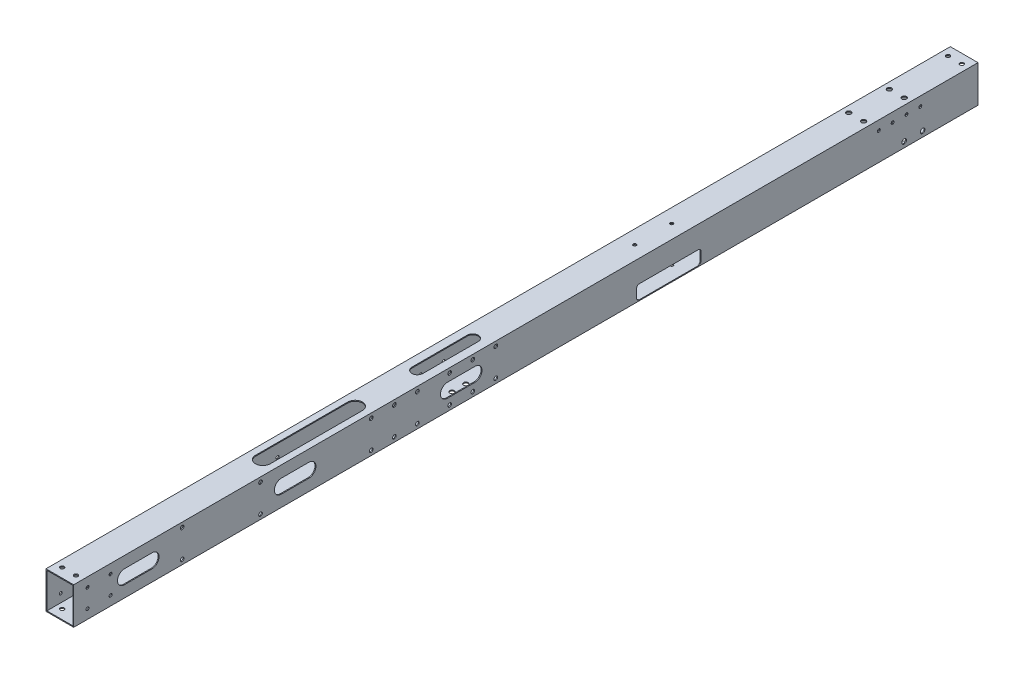
from build123d import *

# Parameters (mm, degrees)
SKETCH_1_W             = 30
SKETCH_1_H             = 40
SKETCH_1_W_2           = 28
SKETCH_1_H_2           = 38
EXTRUDE_1_DEPTH        = 940
SKETCH_5_R             = 2.5
CUT_EXTRUDE_3_DEPTH    = 941.97024395
CUT_EXTRUDE_4_DEPTH    = 1
SKETCH_7_R             = 1.75
CUT_EXTRUDE_5_DEPTH    = 1
SKETCH_17_W            = 30
SKETCH_17_H            = 40
SKETCH_17_W_2          = 28
SKETCH_17_H_2          = 38
EXTRUDE_2_DEPTH        = 20
SKETCH_18_W            = 30
SKETCH_18_H            = 40
SKETCH_18_W_2          = 28
SKETCH_18_H_2          = 38
EXTRUDE_3_DEPTH        = 20
SKETCH_19_R            = 2.1
CUT_EXTRUDE_16_DEPTH   = 961.950050731
SKETCH_20_R            = 1.6
CUT_EXTRUDE_17_DEPTH   = 961.67684473
SKETCH_21_R            = 2.5
SKETCH_21_R_2          = 1.6
CUT_EXTRUDE_18_DEPTH   = 961.67684473
SKETCH_23_R            = 2.5
CUT_EXTRUDE_19_DEPTH   = 961.950050731
SKETCH_24_R            = 4.5
CUT_EXTRUDE_20_DEPTH   = 10
SKETCH_26_R            = 2
CUT_EXTRUDE_22_DEPTH   = 961.67684473
CUT_EXTRUDE_28_DEPTH   = 10
PATTERN_LINEAR_4_COUNT = 2
PATTERN_LINEAR_4_PITCH = 255
PATTERN_LINEAR_8_COUNT = 2
PATTERN_LINEAR_8_PITCH = 205
PATTERN_LINEAR_9_COUNT = 2
PATTERN_LINEAR_9_PITCH = 230
CUT_EXTRUDE_START      = -20
SKETCH_34_R            = 1.75
CUT_EXTRUDE_29_DEPTH   = 20
SKETCH_35_R            = 1.5
CUT_EXTRUDE_30_DEPTH   = 10
CUT_EXTRUDE_31_DEPTH   = 10
SKETCH_37_R            = 1.65
CUT_EXTRUDE_32_DEPTH   = 52
SKETCH_39_R            = 1.75
CUT_EXTRUDE_33_DEPTH   = 10
SKETCH_40_W            = 70
SKETCH_40_H            = 15
CUT_EXTRUDE_34_DEPTH   = 10
EXTRUDE_5_DEPTH        = 1
SKETCH_43_W            = 38.522995696
SKETCH_43_H            = 13.00002022
EXTRUDE_6_DEPTH        = 1
FILLET_1_R             = 3
CUT_EXTRUDE_35_DEPTH   = 10


with BuildPart() as part:
    # 草图1 → 凸台-拉伸1 (new body)
    with BuildSketch(Plane.XY):
        Rectangle(SKETCH_1_W, SKETCH_1_H)
        Rectangle(SKETCH_1_W_2, SKETCH_1_H_2, mode=Mode.SUBTRACT)
    extrude(amount=EXTRUDE_1_DEPTH)

    # 草图5 → 切除-拉伸3 (cut, through all)
    with BuildSketch(Plane.XZ.offset(20)):
        with Locations((-8, 53)):
            Circle(SKETCH_5_R)
        with Locations((8, 53)):
            Circle(SKETCH_5_R)
        with Locations((-8, 97)):
            Circle(SKETCH_5_R)
        with Locations((8, 97)):
            Circle(SKETCH_5_R)
    extrude(amount=-CUT_EXTRUDE_3_DEPTH, mode=Mode.SUBTRACT)

    # 草图6 → 切除-拉伸4 (cut)
    with BuildSketch(Plane(origin=(15, 0, 0), x_dir=(0, 0, -1), z_dir=(1, 0, 0))):
        with BuildLine():
            Line((-345, -7.5), (-375, -7.5))
            ThreePointArc((-375, -7.5), (-382.5, 0), (-375, 7.5))
            Line((-375, 7.5), (-345, 7.5))
            ThreePointArc((-345, 7.5), (-337.5, 0), (-345, -7.5))
        make_face()
        with BuildLine():
            Line((-525, -7.5), (-555, -7.5))
            ThreePointArc((-555, -7.5), (-562.5, 0), (-555, 7.5))
            Line((-555, 7.5), (-525, 7.5))
            ThreePointArc((-525, 7.5), (-517.5, 0), (-525, -7.5))
        make_face()
        with BuildLine():
            Line((-705, -7.5), (-735, -7.5))
            ThreePointArc((-735, -7.5), (-742.5, 0), (-735, 7.5))
            Line((-735, 7.5), (-705, 7.5))
            ThreePointArc((-705, 7.5), (-697.5, 0), (-705, -7.5))
        make_face()
    extrude(amount=-CUT_EXTRUDE_4_DEPTH, mode=Mode.SUBTRACT)

    # 草图7 → 切除-拉伸5 (cut)
    with BuildSketch(Plane.ZY.offset(15)):
        with Locations((350, 0)):
            Circle(SKETCH_7_R)
        with Locations((375, 0)):
            Circle(SKETCH_7_R)
        with Locations((530, 0)):
            Circle(SKETCH_7_R)
        with Locations((555, 0)):
            Circle(SKETCH_7_R)
        with Locations((710, 0)):
            Circle(SKETCH_7_R)
        with Locations((735, 0)):
            Circle(SKETCH_7_R)
    extrude(amount=-CUT_EXTRUDE_5_DEPTH, mode=Mode.SUBTRACT)

    # 草图17 → 凸台-拉伸2 (add)
    with BuildSketch(Plane.XY.offset(940)):
        Rectangle(SKETCH_17_W, SKETCH_17_H)
        Rectangle(SKETCH_17_W_2, SKETCH_17_H_2, mode=Mode.SUBTRACT)
    extrude(amount=EXTRUDE_2_DEPTH)

    # 草图18 → 凸台-拉伸3 (add)
    with BuildSketch(Plane(origin=(0, 0, 0), x_dir=(-1, 0, 0), z_dir=(0, 0, -1))):
        Rectangle(SKETCH_18_W, SKETCH_18_H)
        Rectangle(SKETCH_18_W_2, SKETCH_18_H_2, mode=Mode.SUBTRACT)
    extrude(amount=EXTRUDE_3_DEPTH)

    # 草图19 → 切除-拉伸16 (cut, through all)
    with BuildSketch(Plane(origin=(0, 20, 0), x_dir=(1, 0, 0), z_dir=(0, 1, 0))):
        with Locations((-7.5, -950)):
            Circle(SKETCH_19_R)
        with Locations((7.5, -950)):
            Circle(SKETCH_19_R)
        with Locations((-7.5, 10)):
            Circle(SKETCH_19_R)
        with Locations((7.5, 10)):
            Circle(SKETCH_19_R)
    extrude(amount=-CUT_EXTRUDE_16_DEPTH, mode=Mode.SUBTRACT)

    # 草图20 → 切除-拉伸17 (cut, through all)
    with BuildSketch(Plane(origin=(15, 0, 0), x_dir=(0, 0, -1), z_dir=(1, 0, 0))):
        with Locations((-945, 10)):
            Circle(SKETCH_20_R)
        with Locations((-920, 10)):
            Circle(SKETCH_20_R)
        with Locations((-920, -10)):
            Circle(SKETCH_20_R)
        with Locations((-945, -10)):
            Circle(SKETCH_20_R)
    extrude(amount=-CUT_EXTRUDE_17_DEPTH, mode=Mode.SUBTRACT)

    # 草图21 → 切除-拉伸18 (cut, through all)
    with BuildSketch(Plane(origin=(15, 0, 0), x_dir=(0, 0, -1), z_dir=(1, 0, 0))):
        with Locations((-40, -14)):
            Circle(SKETCH_21_R)
        with Locations((-60, -14)):
            Circle(SKETCH_21_R)
        with Locations((-42.5, 10)):
            Circle(SKETCH_21_R_2)
        with Locations((-57.5, 10)):
            Circle(SKETCH_21_R_2)
        with Locations((-72.5, 10)):
            Circle(SKETCH_21_R_2)
        with Locations((-87.5, 10)):
            Circle(SKETCH_21_R_2)
    extrude(amount=-CUT_EXTRUDE_18_DEPTH, mode=Mode.SUBTRACT)

    # 草图23 → 切除-拉伸19 (cut, through all)
    with BuildSketch(Plane(origin=(0, 20, 0), x_dir=(1, 0, 0), z_dir=(0, 1, 0))):
        with Locations((0, -520)):
            Circle(SKETCH_23_R)
        with Locations((0, -535)):
            Circle(SKETCH_23_R)
        with Locations((0, -550)):
            Circle(SKETCH_23_R)
        with Locations((0, -565)):
            Circle(SKETCH_23_R)
    extrude(amount=-CUT_EXTRUDE_19_DEPTH, mode=Mode.SUBTRACT)

    # 草图24 → 切除-拉伸20 (cut)
    with BuildSketch(Plane(origin=(0, 20, 0), x_dir=(1, 0, 0), z_dir=(0, 1, 0))):
        with Locations((0, -520)):
            Circle(SKETCH_24_R)
        with Locations((0, -535)):
            Circle(SKETCH_24_R)
        with Locations((0, -550)):
            Circle(SKETCH_24_R)
        with Locations((0, -565)):
            Circle(SKETCH_24_R)
    extrude(amount=-CUT_EXTRUDE_20_DEPTH, mode=Mode.SUBTRACT)

    # 草图26 → 切除-拉伸22 (cut, through all)
    with BuildSketch(Plane(origin=(15, 0, 0), x_dir=(0, 0, -1), z_dir=(1, 0, 0))):
        with Locations((-842.5, 15)):
            Circle(SKETCH_26_R)
        with Locations((-842.5, -15)):
            Circle(SKETCH_26_R)
        with Locations((-757.5, -15)):
            Circle(SKETCH_26_R)
        with Locations((-757.5, 15)):
            Circle(SKETCH_26_R)
    cut_extrude_22 = extrude(amount=-CUT_EXTRUDE_22_DEPTH, mode=Mode.SUBTRACT)

    # 草图33 → 切除-拉伸28 (cut)
    with BuildSketch(Plane(origin=(0, 20, 0), x_dir=(1, 0, 0), z_dir=(0, 1, 0))):
        with BuildLine():
            Line((6, -512.5), (6, -572.5))
            ThreePointArc((6, -572.5), (0, -578.5), (-6, -572.5))
            Line((-6, -572.5), (-6, -512.5))
            ThreePointArc((-6, -512.5), (0, -506.5), (6, -512.5))
        make_face()
    extrude(amount=-CUT_EXTRUDE_28_DEPTH, mode=Mode.SUBTRACT)

    # 阵列(线性)4: 切除-拉伸22 ×2
    with Locations(*[(0, 0, -i * PATTERN_LINEAR_4_PITCH) for i in range(1, PATTERN_LINEAR_4_COUNT)]):
        add(cut_extrude_22, mode=Mode.SUBTRACT)

    # 阵列(线性)8: 切除-拉伸22 ×2
    with Locations(*[(0, 0, -i * PATTERN_LINEAR_8_PITCH) for i in range(1, PATTERN_LINEAR_8_COUNT)]):
        add(cut_extrude_22, mode=Mode.SUBTRACT)

    # 阵列(线性)9: 切除-拉伸22 ×2
    with Locations(*[(0, 0, -i * PATTERN_LINEAR_9_PITCH) for i in range(1, PATTERN_LINEAR_9_COUNT)]):
        add(cut_extrude_22, mode=Mode.SUBTRACT)

    # 草图34 → 切除-拉伸29 (cut)
    with BuildSketch(Plane(origin=(15, 0, 0), x_dir=(0, 0, -1), z_dir=(1, 0, 0)).offset(CUT_EXTRUDE_START)):
        with Locations((-905, 0)):
            Circle(SKETCH_34_R)
        with Locations((-880, 0)):
            Circle(SKETCH_34_R)
    extrude(amount=-CUT_EXTRUDE_29_DEPTH, mode=Mode.SUBTRACT)

    # 草图35 → 切除-拉伸30 (cut)
    with BuildSketch(Plane.XZ.offset(20)):
        with Locations((5, 720)):
            Circle(SKETCH_35_R)
        with Locations((5, 700)):
            Circle(SKETCH_35_R)
        with Locations((5, 680)):
            Circle(SKETCH_35_R)
        with Locations((5, 660)):
            Circle(SKETCH_35_R)
        with Locations((5, 640)):
            Circle(SKETCH_35_R)
        with Locations((5, 740)):
            Circle(SKETCH_35_R)
    extrude(amount=-CUT_EXTRUDE_30_DEPTH, mode=Mode.SUBTRACT)

    # 草图36 → 切除-拉伸31 (cut)
    with BuildSketch(Plane(origin=(0, 20, 0), x_dir=(1, 0, 0), z_dir=(0, 1, 0))):
        with BuildLine():
            Line((8, -640), (8, -740))
            ThreePointArc((8, -740), (0, -748), (-8, -740))
            Line((-8, -740), (-8, -640))
            ThreePointArc((-8, -640), (0, -632), (8, -640))
        make_face()
    extrude(amount=-CUT_EXTRUDE_31_DEPTH, mode=Mode.SUBTRACT)

    # 草图37 → 切除-拉伸32 (cut)
    with BuildSketch(Plane(origin=(0, 20, 0), x_dir=(1, 0, 0), z_dir=(0, 1, 0))):
        with Locations((0, -297)):
            Circle(SKETCH_37_R)
        with Locations((0, -337)):
            Circle(SKETCH_37_R)
    extrude(amount=-CUT_EXTRUDE_32_DEPTH, mode=Mode.SUBTRACT)

    # 草图39 → 切除-拉伸33 (cut)
    with BuildSketch(Plane.XZ.offset(20)):
        with Locations((0, 137)):
            Circle(SKETCH_39_R)
        with Locations((0, 177)):
            Circle(SKETCH_39_R)
    extrude(amount=-CUT_EXTRUDE_33_DEPTH, mode=Mode.SUBTRACT)

    # 草图40 → 切除-拉伸34 (cut)
    with BuildSketch(Plane(origin=(15, 0, 0), x_dir=(0, 0, -1), z_dir=(1, 0, 0))):
        with Locations((-315, -11.5)):
            Rectangle(SKETCH_40_W, SKETCH_40_H)
    extrude(amount=-CUT_EXTRUDE_34_DEPTH, mode=Mode.SUBTRACT)

    # 草图42 → 凸台-拉伸5 (add)
    with BuildSketch(Plane(origin=(15, 0, 0), x_dir=(0, 0, -1), z_dir=(1, 0, 0))):
        Polygon((-350, -8.24794841), (-350, -4), (-334.23295051, -4), (-334.23295051, 12.222841732), (-383.610977641, 12.222841732), (-383.610977641, -8.24794841), align=None)
    extrude(amount=-EXTRUDE_5_DEPTH)

    # 草图43 → 凸台-拉伸6 (add)
    with BuildSketch(Plane.ZY.offset(15)):
        with Locations((362.400416305, 1.435266839)):
            Rectangle(SKETCH_43_W, SKETCH_43_H)
    extrude(amount=-EXTRUDE_6_DEPTH)

    # 圆角1
    fillet_1_edges = [part.edges().sort_by_distance(p)[0] for p in [
        (14.5, -19, 280),
        (14.5, -4, 280),
        (14.5, -19, 350),
        (14.5, -4, 350),
    ]]
    fillet(fillet_1_edges, radius=FILLET_1_R)

    # 草图44 → 切除-拉伸35 (cut)
    with BuildSketch(Plane(origin=(15, 0, 0), x_dir=(0, 0, -1), z_dir=(1, 0, 0))):
        with BuildLine():
            ThreePointArc((-875, -7.5), (-867.5, 0), (-875, 7.5))
            Line((-875, 7.5), (-905, 7.5))
            ThreePointArc((-905, 7.5), (-912.5, 0), (-905, -7.5))
            Line((-905, -7.5), (-875, -7.5))
        make_face()
    extrude(amount=-CUT_EXTRUDE_35_DEPTH, mode=Mode.SUBTRACT)


solid = part.part
